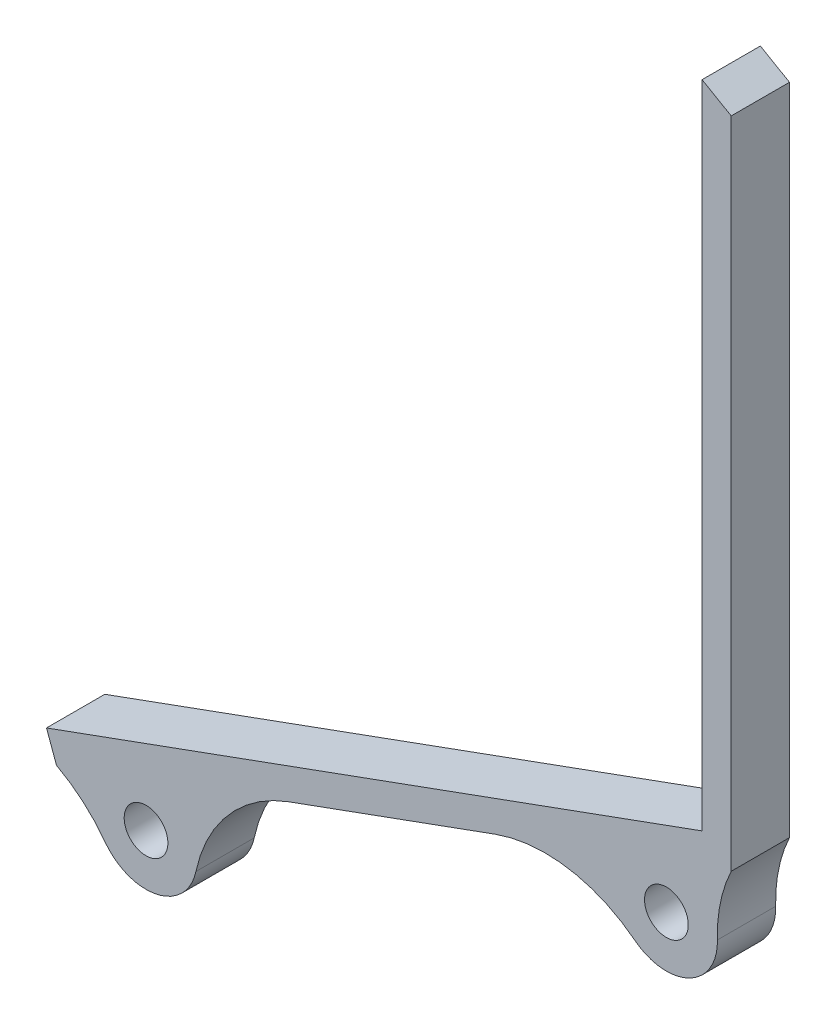
from build123d import *

# Parameters (mm, degrees)
BOSS_EXTRUDE1_DEPTH = 4
SKETCH3_R           = 1.5
BOSS_EXTRUDE3_DEPTH = 4
LPATTERN2_COUNT     = 2
LPATTERN2_PITCH     = 38
FILLET1_DEPTH       = 4


with BuildPart() as part:
    # Sketch1 → Boss-Extrude1 (new body)
    with BuildSketch(Plane.XY):
        Polygon((23.699409247, -33.383107264), (23.015368961, -31.503722023), (70, -14.402714856), (70, -16.531070401), align=None)
        Polygon((68, -15.130655325), (70, -14.402714856), (70, 28.358983849), (68, 29.513684387), align=None)
    extrude(amount=BOSS_EXTRUDE1_DEPTH)

    # Sketch3 → Boss-Extrude3 (add)
    # profile 1 of 3: a face of its own
    with BuildSketch(Plane(origin=(0, 0, 0), x_dir=(-1, 0, 0), z_dir=(0, 0, -1))):
        with BuildLine():
            ThreePointArc((-33.133334302, -32.988363728), (-31.041480631, -37.474358403), (-26.555485957, -35.382504732))
            ThreePointArc((-26.555485957, -35.382504732), (-26.397582994, -34.793202852), (-26.34441013, -34.18543423))
            ThreePointArc((-26.34441013, -34.18543423), (-26.503443688, -33.142389054), (-26.96609198, -32.194131985))
            Line((-26.96609198, -32.194131985), (-30.769345343, -30.809860967))
            ThreePointArc((-30.769345343, -30.809860967), (-32.216249353, -31.61164739), (-33.133334302, -32.988363728))
        make_face()
        with Locations((-29.84441013, -34.18543423)):
            Circle(SKETCH3_R, mode=Mode.SUBTRACT)
    # profile 2 of 3: a face of its own
    with BuildSketch(Plane(origin=(0, 0, 0), x_dir=(-1, 0, 0), z_dir=(0, 0, -1))):
        with BuildLine():
            ThreePointArc((-26.34441013, -34.18543423), (-26.397582994, -34.793202852), (-26.555485957, -35.382504732))
            Line((-26.555485957, -35.382504732), (-25.578794489, -32.699066978))
            Line((-25.578794489, -32.699066978), (-26.96609198, -32.194131985))
            ThreePointArc((-26.96609198, -32.194131985), (-26.503443688, -33.142389054), (-26.34441013, -34.18543423))
        make_face()
    # profile 3 of 3: a face of its own
    with BuildSketch(Plane(origin=(0, 0, 0), x_dir=(-1, 0, 0), z_dir=(0, 0, -1))):
        with BuildLine():
            Line((-32.156642834, -30.304925974), (-33.133334302, -32.988363728))
            ThreePointArc((-33.133334302, -32.988363728), (-32.216249353, -31.61164739), (-30.769345343, -30.809860967))
            Line((-30.769345343, -30.809860967), (-32.156642834, -30.304925974))
        make_face()
    boss_extrude3 = extrude(amount=-BOSS_EXTRUDE3_DEPTH)

    # LPattern2: Boss-Extrude3 ×2
    with Locations(*[Vector(0.9396926207859079, 0.3420201433256704, 0) * (i * LPATTERN2_PITCH) for i in range(1, LPATTERN2_COUNT)]):
        add(boss_extrude3)

    # Fillet1: read off the stored shape, not the designer's step
    # Fillet1 outline → Fillet1 (add)
    with BuildSketch(Plane.XY):
        with BuildLine():
            ThreePointArc((68.841653892, -19.991598282), (68.990249602, -20.53029423), (69.051216895, -21.085773301))
            ThreePointArc((69.051216895, -21.085773301), (69.257041708, -18.75247713), (70, -16.531070401))
            Line((70, -16.531070401), (67.864962424, -17.308160528))
            Line((67.864962424, -17.308160528), (68.841653892, -19.991598282))
        make_face()
        with BuildLine():
            Line((61.287114079, -19.702301531), (53.812215852, -22.42294199))
            ThreePointArc((53.812215852, -22.42294199), (58.800886589, -21.943638956), (63.395611681, -23.944905669))
            ThreePointArc((63.395611681, -23.944905669), (62.720311337, -23.244734469), (62.263805547, -22.385739285))
            Line((62.263805547, -22.385739285), (61.287114079, -19.702301531))
        make_face()
        with BuildLine():
            ThreePointArc((33.133334302, -32.988363728), (33.33578204, -33.939828481), (33.268533335, -34.910265432))
            ThreePointArc((33.268533335, -34.910265432), (35.501907513, -30.423773828), (39.631541062, -27.584285515))
            Line((39.631541062, -27.584285515), (32.156642834, -30.304925974))
            Line((32.156642834, -30.304925974), (33.133334302, -32.988363728))
        make_face()
        with BuildLine():
            ThreePointArc((23.699409247, -33.383107264), (25.524081147, -34.637762706), (27.027892588, -36.263228478))
            ThreePointArc((27.027892588, -36.263228478), (26.760091208, -35.839815319), (26.555485957, -35.382504732))
            Line((26.555485957, -35.382504732), (25.578794489, -32.699066978))
            Line((25.578794489, -32.699066978), (23.699409247, -33.383107264))
        make_face()
    extrude(amount=FILLET1_DEPTH)


solid = part.part
